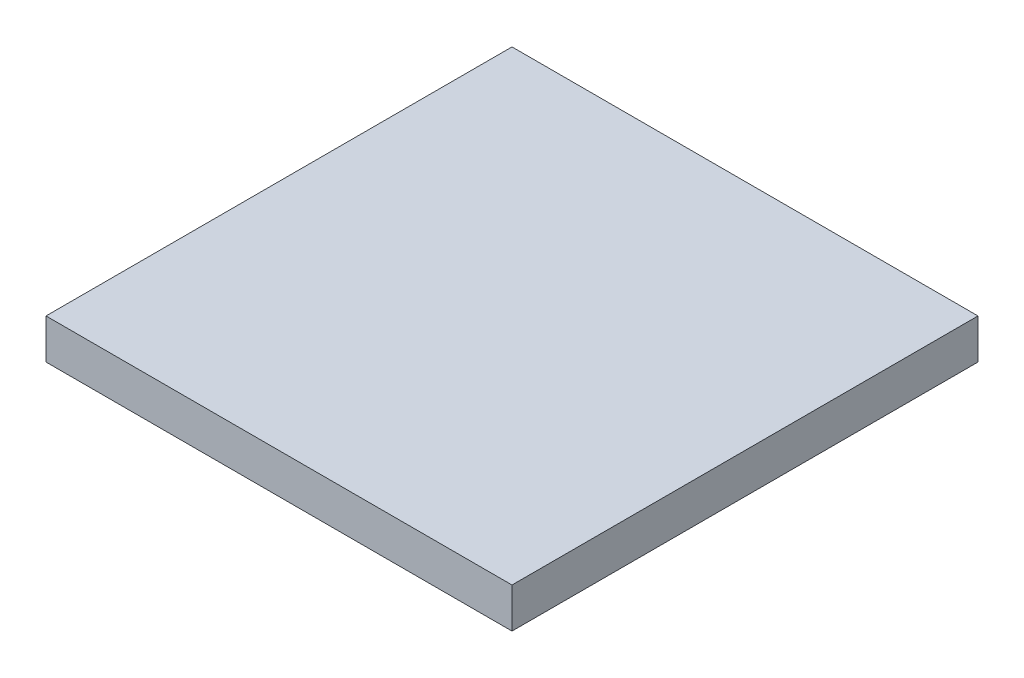
from build123d import *

# Parameters (mm, degrees)
SKETCH1_W           = 70
SKETCH1_H           = 70
BOSS_EXTRUDE1_DEPTH = 6


with BuildPart() as part:
    # Sketch1 → Boss-Extrude1 (new body)
    with BuildSketch(Plane(origin=(0, 0, 0), x_dir=(1, 0, 0), z_dir=(0, 1, 0))):
        Rectangle(SKETCH1_W, SKETCH1_H)
    extrude(amount=BOSS_EXTRUDE1_DEPTH)


solid = part.part
